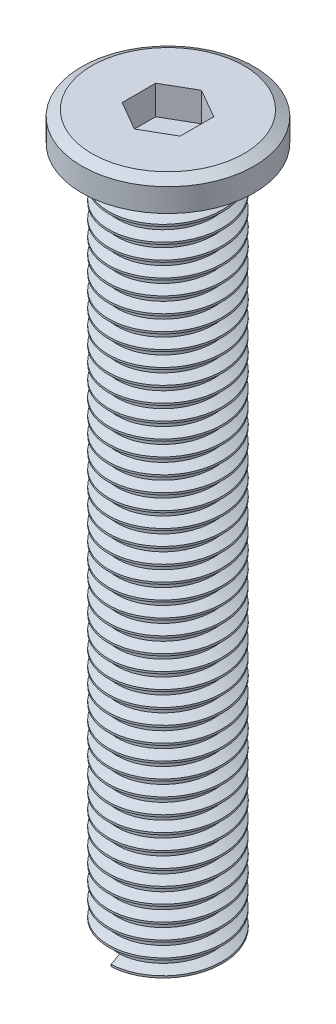
from build123d import *
from build123d.topology import SkipClean

# Parameters (mm, degrees)
SKETCH1_R           = 4.45
BOSS_EXTRUDE1_DEPTH = 1.5
CHAMFER2_SIZE       = 0.3
CHAMFER2_SIZE2      = 0.519615242
CUT_EXTRUDE1_DEPTH  = 3
SKETCH3_R           = 2.5
BOSS_EXTRUDE2_DEPTH = 35
THREAD1_PITCH       = 0.8


with BuildPart() as part:
    # Sketch1 → Boss-Extrude1 (new body)
    with BuildSketch(Plane(origin=(0, 0, 0), x_dir=(1, 0, 0), z_dir=(0, 1, 0))):
        with Locations(Location((0, 0, 0), (0, 0, 270))):
            Circle(SKETCH1_R)
    extrude(amount=BOSS_EXTRUDE1_DEPTH)

    # Chamfer2
    chamfer2_edges = [part.edges().sort_by_distance(p)[0] for p in [
        (0, 1.5, -4.45),
    ]]
    chamfer2_side = [part.faces().sort_by_distance(p)[0] for p in [
        (0, 0.75, -4.45),
    ]]
    chamfer(chamfer2_edges, length=CHAMFER2_SIZE, length2=CHAMFER2_SIZE2, reference=chamfer2_side[0])

    # Sketch8 → Cut-Extrude1 (cut)
    with BuildSketch(Plane(origin=(0, 1.5, 0), x_dir=(1, 0, 0), z_dir=(0, 1, 0))):
        Polygon((0, 1.732050808), (-1.5, 0.866025404), (-1.5, -0.866025404), (0, -1.732050808), (1.5, -0.866025404), (1.5, 0.866025404), align=None)
    extrude(amount=-CUT_EXTRUDE1_DEPTH, mode=Mode.SUBTRACT)

    # Sketch3 → Boss-Extrude2 (add)
    with BuildSketch(Plane.XZ):
        with Locations(Location((0, 0, 0), (0, 0, 90))):
            Circle(SKETCH3_R)
    extrude(amount=BOSS_EXTRUDE2_DEPTH)

    # Thread1: arcs per turn and ends read off the stored shape
    # Thread1: the profile of Thread Profile2 profile screwed along a right-hand helix through 43.75 turns, 8 arcs to a turn; built about Z, then put on its axis
    with SkipClean():  # the faces are left unmerged after this step: merging them gives an invalid solid
        thread1_z = Axis((0, 0, 0), (0, 0, 1))
        thread1_corners = [(2.4994, 0, -0.00034641), (2.9330127, 0, 0.249999999), (2.9330127, 0, 0.349999999), (2.4994, 0, 0.600346408)]
        with BuildLine(mode=Mode.PRIVATE) as thread1_profile:
            Line(thread1_corners[0], thread1_corners[1])
            Line(thread1_corners[1], thread1_corners[2])
            Line(thread1_corners[2], thread1_corners[3])
            Line(thread1_corners[3], thread1_corners[0])
        thread1_cap = Face(thread1_profile.wire())
        thread1_turn_angles = [0, 22.5, 45, 67.5, 90, 112.5, 135, 157.5, 180, 202.5, 225, 247.5, 270, 292.5, 315, 337.5, 360]
        thread1_turn_weights = [1, 0.9238795325112867, 1, 0.9238795325112867, 1, 0.9238795325112867, 1, 0.9238795325112867, 1, 0.9238795325112867, 1, 0.9238795325112867, 1, 0.9238795325112867, 1, 0.9238795325112867, 1]
        thread1_turn_rails = [Edge.make_bspline([Vector(p[0], p[1], 0).rotate(thread1_z, thread1_turn_angles[k]) / thread1_turn_weights[k] + Vector(0, 0, p[2] + THREAD1_PITCH * thread1_turn_angles[k] / 360) for k in range(17)], [0, 0, 0, 1, 1, 2, 2, 3, 3, 4, 4, 5, 5, 6, 6, 7, 7, 8, 8, 8], 2, thread1_turn_weights) for p in thread1_corners]
        thread1_turn_sides = [Face.make_surface_from_curves(thread1_turn_rails[p[0]], thread1_turn_rails[p[1]]) for p in [(0, 1), (1, 2), (2, 3), (3, 0)]]
        thread1_last_angles = [15480, 15502.5, 15525, 15547.5, 15570, 15592.5, 15615, 15637.5, 15660, 15682.5, 15705, 15727.5, 15750]
        thread1_last_weights = [1, 0.9238795325112867, 1, 0.9238795325112867, 1, 0.9238795325112867, 1, 0.9238795325112867, 1, 0.9238795325112867, 1, 0.9238795325112867, 1]
        thread1_last_rails = [Edge.make_bspline([Vector(p[0], p[1], 0).rotate(thread1_z, thread1_last_angles[k]) / thread1_last_weights[k] + Vector(0, 0, p[2] + THREAD1_PITCH * thread1_last_angles[k] / 360) for k in range(13)], [0, 0, 0, 1, 1, 2, 2, 3, 3, 4, 4, 5, 5, 6, 6, 6], 2, thread1_last_weights) for p in thread1_corners]
        thread1_last_sides = [Face.make_surface_from_curves(thread1_last_rails[p[0]], thread1_last_rails[p[1]]) for p in [(0, 1), (1, 2), (2, 3), (3, 0)]]
        thread1 = Plane(origin=(0, 0, 0), x_dir=(-1, 0, 0), z_dir=(0, -1, 0)) * Solid(Shell([*[p.moved(Location((0, 0, THREAD1_PITCH * i))) for i in range(43) for p in thread1_turn_sides], *thread1_last_sides, thread1_cap, thread1_cap.rotate(thread1_z, 15750).moved(Location((0, 0, THREAD1_PITCH * 15750 / 360)))]))
        add(thread1)


solid = part.part
